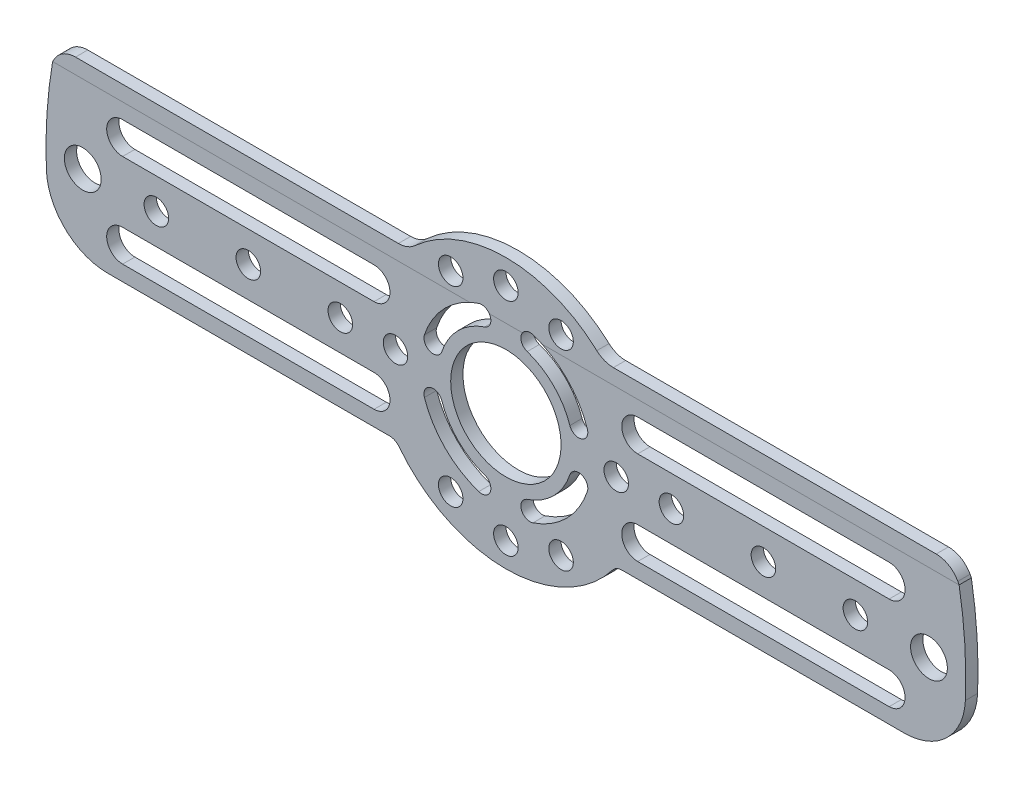
from build123d import *

# Parameters (mm, degrees)
SKETCH1_R           = 2
SKETCH1_R_2         = 3
BOSS_EXTRUDE1_DEPTH = 2
SKETCH3_R           = 9
SKETCH3_R_2         = 2
CUT_EXTRUDE1_DEPTH  = 93.316865626
CUT_EXTRUDE2_DEPTH  = 93.316865626
CUT_EXTRUDE3_DEPTH  = 93.316865626
FILLET1_R           = 2
FILLET2_DEPTH       = 2
FILLET3_DEPTH       = 2
FILLET4_DEPTH       = 2
FILLET5_DEPTH       = 2
FILLET6_R           = 10
CUT_EXTRUDE4_DEPTH  = 10
CUT_EXTRUDE5_START  = -10
CUT_EXTRUDE5_DEPTH  = 10
FILLET7_R           = 4


with BuildPart() as part:
    # Sketch1 → Boss-Extrude1 (new body)
    with BuildSketch(Plane.XY):
        with BuildLine():
            Line((-73.916912814, -12.7), (-17.964130928, -12.7))
            ThreePointArc((-17.964130928, -12.7), (0, -22), (17.964130928, -12.7))
            Line((17.964130928, -12.7), (73.916912814, -12.7))
            ThreePointArc((73.916912814, -12.7), (75, 0), (73.916912814, 12.7))
            Line((73.916912814, 12.7), (53.192030909, 51.162152625))
            ThreePointArc((53.192030909, 51.162152625), (51.353674008, 53.083322806), (48.790367902, 53.790367902))
            Line((48.790367902, 53.790367902), (-48.790367902, 53.790367902))
            ThreePointArc((-48.790367902, 53.790367902), (-51.353674008, 53.083322806), (-53.192030909, 51.162152625))
            Line((-53.192030909, 51.162152625), (-73.916912814, 12.7))
            ThreePointArc((-73.916912814, 12.7), (-75, 0), (-73.916912814, -12.7))
        make_face()
        with Locations((0, 18)):
            Circle(SKETCH1_R, mode=Mode.SUBTRACT)
        with Locations((-48.790367902, 48.790367902)):
            Circle(SKETCH1_R_2, mode=Mode.SUBTRACT)
        with Locations((-69, 0)):
            Circle(SKETCH1_R_2, mode=Mode.SUBTRACT)
        with Locations(Location((69, 0, 0), (0, 0, 180))):
            Circle(SKETCH1_R_2, mode=Mode.SUBTRACT)
        with Locations(Location((48.790367902, 48.790367902, 0), (0, 0, 180))):
            Circle(SKETCH1_R_2, mode=Mode.SUBTRACT)
        with Locations((9, 15.588457268)):
            Circle(SKETCH1_R, mode=Mode.SUBTRACT)
        with Locations((18, 0)):
            Circle(SKETCH1_R, mode=Mode.SUBTRACT)
        with Locations((9, -15.588457268)):
            Circle(SKETCH1_R, mode=Mode.SUBTRACT)
        with Locations((0, -18)):
            Circle(SKETCH1_R, mode=Mode.SUBTRACT)
        with Locations((-9, -15.588457268)):
            Circle(SKETCH1_R, mode=Mode.SUBTRACT)
        with Locations((-18, 0)):
            Circle(SKETCH1_R, mode=Mode.SUBTRACT)
        with Locations((-9, 15.588457268)):
            Circle(SKETCH1_R, mode=Mode.SUBTRACT)
    extrude(amount=BOSS_EXTRUDE1_DEPTH)

    # Sketch3 → Cut-Extrude1 (cut, through all)
    with BuildSketch(Plane(origin=(0, 0, 0), x_dir=(-1, 0, 0), z_dir=(0, 0, -1))):
        Circle(SKETCH3_R)
        with Locations((-57, 0)):
            Circle(SKETCH3_R_2)
        with Locations((-42, 0)):
            Circle(SKETCH3_R_2)
        with Locations((-27, 0)):
            Circle(SKETCH3_R_2)
        with Locations(Location((27, 0, 0), (0, 0, 180))):
            Circle(SKETCH3_R_2)
        with Locations(Location((42, 0, 0), (0, 0, 180))):
            Circle(SKETCH3_R_2)
        with Locations(Location((57, 0, 0), (0, 0, 180))):
            Circle(SKETCH3_R_2)
    extrude(amount=-CUT_EXTRUDE1_DEPTH, mode=Mode.SUBTRACT)

    # Sketch5 → Cut-Extrude2 (cut, through all)
    with BuildSketch(Plane.XY.offset(2)):
        with BuildLine():
            ThreePointArc((-47.496272676, 43.96073877), (-49.370145803, 43.824095901), (-51.162152625, 44.388704895))
            Line((-51.162152625, 44.388704895), (-66.890145486, 15.2))
            Line((-66.890145486, 15.2), (-18.735533906, 15.2))
            Line((-18.735533906, 15.2), (-47.496272676, 43.96073877))
        make_face()
        with BuildLine():
            ThreePointArc((43.96073877, 47.496272676), (43.833143595, 48.137736941), (43.790367902, 48.790367902))
            Line((43.790367902, 48.790367902), (-43.790367902, 48.790367902))
            ThreePointArc((-43.790367902, 48.790367902), (-43.833143595, 48.137736941), (-43.96073877, 47.496272676))
            Line((-43.96073877, 47.496272676), (-13.687814563, 17.223348469))
            ThreePointArc((-13.687814563, 17.223348469), (0, 22), (13.687814563, 17.223348469))
            Line((13.687814563, 17.223348469), (43.96073877, 47.496272676))
        make_face()
        with BuildLine():
            Line((47.496272676, 43.96073877), (18.735533906, 15.2))
            Line((18.735533906, 15.2), (66.890145486, 15.2))
            Line((66.890145486, 15.2), (51.162152625, 44.388704895))
            ThreePointArc((51.162152625, 44.388704895), (49.370145803, 43.824095901), (47.496272676, 43.96073877))
        make_face()
    extrude(amount=-CUT_EXTRUDE2_DEPTH, mode=Mode.SUBTRACT)

    # Sketch8 → Cut-Extrude3 (cut, through all)
    with BuildSketch(Plane.XY.offset(2)):
        with BuildLine():
            Line((-62.500769276, 10.2), (-21.499230724, 10.2))
            ThreePointArc((-21.499230724, 10.2), (-18.899230724, 7.6), (-21.499230724, 5))
            Line((-21.499230724, 5), (-62.500769276, 5))
            ThreePointArc((-62.500769276, 5), (-65.100769276, 7.6), (-62.500769276, 10.2))
        make_face()
        with BuildLine():
            Line((62.500769276, 10.2), (21.499230724, 10.2))
            ThreePointArc((21.499230724, 10.2), (18.899230724, 7.6), (21.499230724, 5))
            Line((21.499230724, 5), (62.500769276, 5))
            ThreePointArc((62.500769276, 5), (65.100769276, 7.6), (62.500769276, 10.2))
        make_face()
        with BuildLine():
            Line((-62.500769276, -10.2), (-21.499230724, -10.2))
            ThreePointArc((-21.499230724, -10.2), (-18.899230724, -7.6), (-21.499230724, -5))
            Line((-21.499230724, -5), (-62.500769276, -5))
            ThreePointArc((-62.500769276, -5), (-65.100769276, -7.6), (-62.500769276, -10.2))
        make_face()
        with BuildLine():
            Line((62.500769276, -10.2), (21.499230724, -10.2))
            ThreePointArc((21.499230724, -10.2), (18.899230724, -7.6), (21.499230724, -5))
            Line((21.499230724, -5), (62.500769276, -5))
            ThreePointArc((62.500769276, -5), (65.100769276, -7.6), (62.500769276, -10.2))
        make_face()
    extrude(amount=-CUT_EXTRUDE3_DEPTH, mode=Mode.SUBTRACT)

    # Fillet1
    fillet1_edges = [part.edges().sort_by_distance(p)[0] for p in [
        (13.687814563, 17.223348469, 1),
        (-13.687814563, 17.223348469, 1),
        (66.890145486, 15.2, 1),
        (18.735533906, 15.2, 1),
        (-18.735533906, 15.2, 1),
        (-66.890145486, 15.2, 1),
        (-17.964130928, -12.7, 1),
        (17.964130928, -12.7, 1),
    ]]
    fillet(fillet1_edges, radius=FILLET1_R)

    # Fillet2: read off the stored shape, not the designer's step
    # Fillet2 outline → Fillet2 (add)
    with BuildSketch(Plane.XY):
        with BuildLine():
            Line((-43.96073877, 47.496272676), (-43.584387401, 47.119921307))
            add(Edge.make_bspline(
                [(-43.584387401, 47.119921307), (-43.797190051, 47.332723957), (-43.913795064, 47.634492396), (-43.857793167, 47.972011936)],
                knots=[0, 0, 0, 0, 0.414217716, 0.414217716, 0.414217716, 0.414217716], degree=3, weights=[1, 0.829531028, 0.729673324, 0.700426888]))
            ThreePointArc((-43.857793167, 47.972011936), (-43.903473382, 47.732888844), (-43.96073877, 47.496272676))
        make_face()
        with BuildLine():
            ThreePointArc((-43.790367902, 48.790367902), (-43.807252728, 48.379803457), (-43.857793167, 47.972011936))
            add(Edge.make_bspline(
                [(-43.857793167, 47.972011936), (-43.770111404, 48.500463831), (-43.357659227, 48.790367902), (-42.892465766, 48.790367902)],
                knots=[0.414217716, 0.414217716, 0.414217716, 0.414217716, 1, 1, 1, 1], degree=3, weights=[0.700426888, 0.65906689, 0.758924594, 1]))
            Line((-42.892465766, 48.790367902), (-43.790367902, 48.790367902))
        make_face()
    extrude(amount=FILLET2_DEPTH)

    # Fillet3: read off the stored shape, not the designer's step
    # Fillet3 outline → Fillet3 (add)
    with BuildSketch(Plane.XY):
        with BuildLine():
            Line((43.790367902, 48.790367902), (42.892465766, 48.790367902))
            add(Edge.make_bspline(
                [(42.892465766, 48.790367902), (43.35766565, 48.790367902), (43.770121357, 48.500456835), (43.85779576, 47.971996305)],
                knots=[0, 0, 0, 0, 0.585788422, 0.585788422, 0.585788422, 0.585788422], degree=3, weights=[1, 0.758922068, 0.659064797, 0.700428188]))
            ThreePointArc((43.85779576, 47.971996305), (43.807253379, 48.379795562), (43.790367902, 48.790367902))
        make_face()
        with BuildLine():
            ThreePointArc((43.96073877, 47.496272676), (43.903475058, 47.732881101), (43.85779576, 47.971996305))
            add(Edge.make_bspline(
                [(43.85779576, 47.971996305), (43.913791135, 47.634482229), (43.79718625, 47.332720155), (43.584387401, 47.119921307)],
                knots=[0.585788422, 0.585788422, 0.585788422, 0.585788422, 1, 1, 1, 1], degree=3, weights=[0.700428188, 0.729676283, 0.829533554, 1]))
            Line((43.584387401, 47.119921307), (43.96073877, 47.496272676))
        make_face()
    extrude(amount=FILLET3_DEPTH)

    # Fillet4: read off the stored shape, not the designer's step
    # Fillet4 outline → Fillet4 (add)
    with BuildSketch(Plane.XY):
        with BuildLine():
            Line((-51.162152625, 44.388704895), (-52.646203655, 41.634537345))
            add(Edge.make_bspline(
                [(-52.646203655, 41.634537345), (-51.921831722, 42.978858822), (-50.57662478, 43.835731972), (-48.922110647, 43.792103818)],
                knots=[0, 0, 0, 0, 0.585789591, 0.585789591, 0.585789591, 0.585789591], degree=3, weights=[1, 0.842636483, 0.777454876, 0.80445518]))
            ThreePointArc((-48.922110647, 43.792103818), (-50.077183995, 43.95879421), (-51.162152625, 44.388704895))
        make_face()
        with BuildLine():
            ThreePointArc((-47.496272676, 43.96073877), (-48.203107092, 43.824975194), (-48.922110647, 43.792103818))
            add(Edge.make_bspline(
                [(-48.922110647, 43.792103818), (-47.817684638, 43.762981028), (-46.849975542, 43.314441636), (-46.126053507, 42.590519601)],
                knots=[0.585789591, 0.585789591, 0.585789591, 0.585789591, 1, 1, 1, 1], degree=3, weights=[0.80445518, 0.823547029, 0.888728636, 1]))
            Line((-46.126053507, 42.590519601), (-47.496272676, 43.96073877))
        make_face()
    extrude(amount=FILLET4_DEPTH)

    # Fillet5: read off the stored shape, not the designer's step
    # Fillet5 outline → Fillet5 (add)
    with BuildSketch(Plane.XY):
        with BuildLine():
            Line((47.496272676, 43.96073877), (46.126053507, 42.590519601))
            add(Edge.make_bspline(
                [(46.126053507, 42.590519601), (46.849974415, 43.314440509), (47.81768175, 43.762979689), (48.922105957, 43.792103694)],
                knots=[0, 0, 0, 0, 0.414209836, 0.414209836, 0.414209836, 0.414209836], degree=3, weights=[1, 0.88872879, 0.823547209, 0.804455259]))
            ThreePointArc((48.922105957, 43.792103694), (48.203104762, 43.824975469), (47.496272676, 43.96073877))
        make_face()
        with BuildLine():
            ThreePointArc((51.162152625, 44.388704895), (50.077181728, 43.958793606), (48.922105957, 43.792103694))
            add(Edge.make_bspline(
                [(48.922105957, 43.792103694), (50.576621929, 43.835733788), (51.921830881, 42.978860382), (52.646203655, 41.634537345)],
                knots=[0.414209836, 0.414209836, 0.414209836, 0.414209836, 1, 1, 1, 1], degree=3, weights=[0.804455259, 0.777454749, 0.842636329, 1]))
            Line((52.646203655, 41.634537345), (51.162152625, 44.388704895))
        make_face()
    extrude(amount=FILLET5_DEPTH)

    # Fillet6
    fillet6_edges = [part.edges().sort_by_distance(p)[0] for p in [
        (-73.916912814, -12.7, 1),
        (73.916912814, -12.7, 1),
    ]]
    fillet(fillet6_edges, radius=FILLET6_R)

    # Sketch9 → Cut-Extrude4 (cut)
    with BuildSketch(Plane(origin=(0, 0, 0), x_dir=(-1, 0, 0), z_dir=(0, 0, -1))):
        with BuildLine():
            ThreePointArc((10.4368, 3.47465189), (7.778174593, 7.778174593), (3.47465189, 10.4368))
            ThreePointArc((3.47465189, 10.4368), (2.525268057, 12.333816167), (4.422284224, 13.2832))
            ThreePointArc((4.422284224, 13.2832), (9.899494937, 9.899494937), (13.2832, 4.422284224))
            ThreePointArc((13.2832, 4.422284224), (12.333816167, 2.525268057), (10.4368, 3.47465189))
        make_face()
        with BuildLine():
            ThreePointArc((-4.422284224, 13.2832), (-9.899494937, 9.899494937), (-13.2832, 4.422284224))
            ThreePointArc((-13.2832, 4.422284224), (-12.333816167, 2.525268057), (-10.4368, 3.47465189))
            ThreePointArc((-10.4368, 3.47465189), (-7.778174593, 7.778174593), (-3.47465189, 10.4368))
            ThreePointArc((-3.47465189, 10.4368), (-2.525268057, 12.333816167), (-4.422284224, 13.2832))
        make_face()
        with BuildLine():
            ThreePointArc((3.47465189, -10.4368), (7.778174593, -7.778174593), (10.4368, -3.47465189))
            ThreePointArc((10.4368, -3.47465189), (12.333816167, -2.525268057), (13.2832, -4.422284224))
            ThreePointArc((13.2832, -4.422284224), (9.899494937, -9.899494937), (4.422284224, -13.2832))
            ThreePointArc((4.422284224, -13.2832), (2.525268057, -12.333816167), (3.47465189, -10.4368))
        make_face()
        with BuildLine():
            ThreePointArc((-10.4368, -3.47465189), (-7.778174593, -7.778174593), (-3.47465189, -10.4368))
            ThreePointArc((-3.47465189, -10.4368), (-2.525268057, -12.333816167), (-4.422284224, -13.2832))
            ThreePointArc((-4.422284224, -13.2832), (-9.899494937, -9.899494937), (-13.2832, -4.422284224))
            ThreePointArc((-13.2832, -4.422284224), (-12.333816167, -2.525268057), (-10.4368, -3.47465189))
        make_face()
    extrude(amount=-CUT_EXTRUDE4_DEPTH, mode=Mode.SUBTRACT)

    # Sketch10 → Cut-Extrude5 (cut)
    with BuildSketch(Plane.XY.offset(2).offset(CUT_EXTRUDE5_START)):
        with BuildLine():
            Line((-63.54060023, 15.2), (-72.569817001, 15.2))
            Line((-72.569817001, 15.2), (-53.192030909, 51.162152625))
            ThreePointArc((-53.192030909, 51.162152625), (-51.353674008, 53.083322806), (-48.790367902, 53.790367902))
            Line((-48.790367902, 53.790367902), (48.790367902, 53.790367902))
            ThreePointArc((48.790367902, 53.790367902), (51.353674008, 53.083322806), (53.192030909, 51.162152625))
            Line((53.192030909, 51.162152625), (72.569817001, 15.2))
            Line((72.569817001, 15.2), (15.904716282, 15.2))
            ThreePointArc((15.904716282, 15.2), (0, 22), (-15.904716282, 15.2))
            Line((-15.904716282, 15.2), (-63.54060023, 15.2))
        make_face()
    extrude(amount=CUT_EXTRUDE5_DEPTH, mode=Mode.SUBTRACT)

    # Fillet7
    fillet7_edges = [part.edges().sort_by_distance(p)[0] for p in [
        (-72.569817001, 15.2, 1),
        (72.569817001, 15.2, 1),
        (-15.904716282, 15.2, 1),
        (15.904716282, 15.2, 1),
    ]]
    fillet(fillet7_edges, radius=FILLET7_R)


solid = part.part
